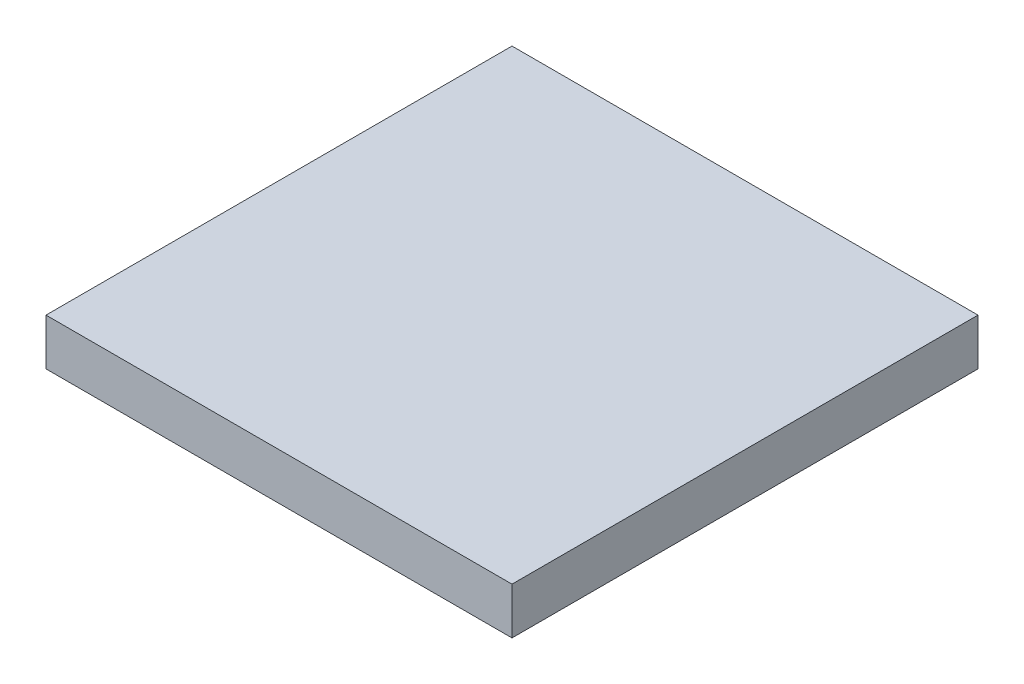
from build123d import *

# Parameters (mm, degrees)
SKETCH1_W           = 300
SKETCH1_H           = 300
BOSS_EXTRUDE1_DEPTH = 30


with BuildPart() as part:
    # Sketch1 → Boss-Extrude1 (new body)
    with BuildSketch(Plane(origin=(0, 0, 0), x_dir=(1, 0, 0), z_dir=(0, 1, 0))):
        with Locations((-100, 0)):
            Rectangle(SKETCH1_W, SKETCH1_H)
    extrude(amount=BOSS_EXTRUDE1_DEPTH)


solid = part.part
